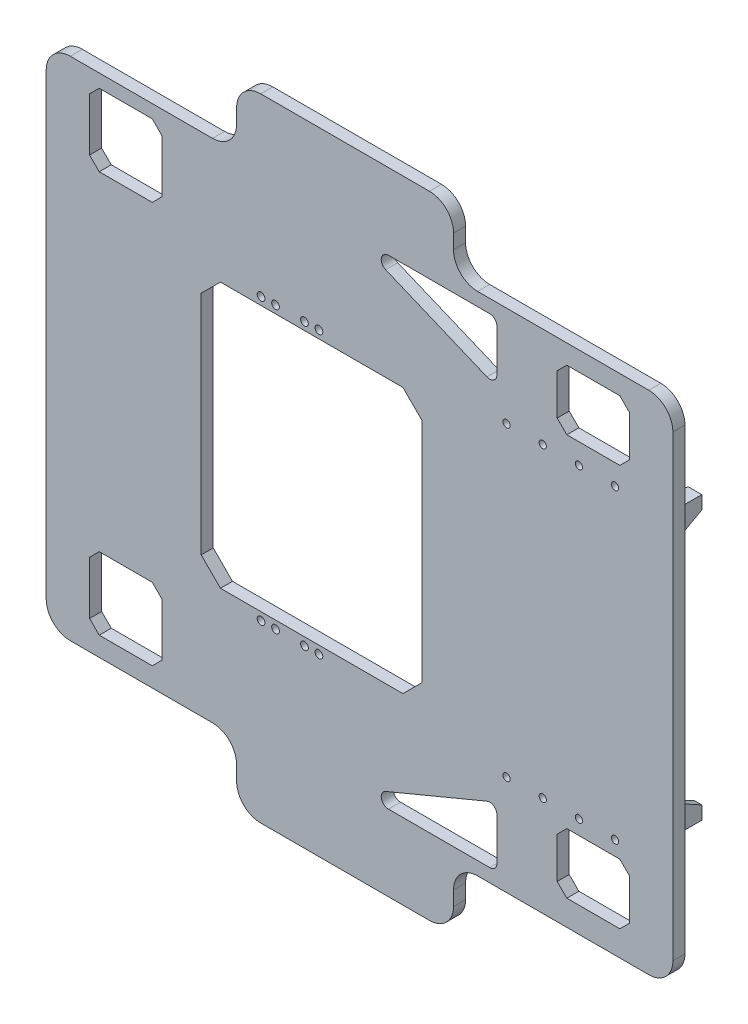
from build123d import *

# Parameters (mm, degrees)
EXTRUDE_1_DEPTH       = 5
CUT_EXTRUDE_1_DEPTH   = 185.623942109
CUT_EXTRUDE_2_DEPTH   = 185.623942109
EXTRUDE_2_DEPTH       = 15
CUT_EXTRUDE_3_DEPTH   = 10
CUT_EXTRUDE_4_DEPTH   = 10
MIRROR_2_COPY_1_DEPTH = 15
MIRROR_2_COPY_2_DEPTH = 10
MIRROR_2_COPY_3_DEPTH = 10
MIRROR_2_COPY_4_DEPTH = 15
MIRROR_2_COPY_5_DEPTH = 10
MIRROR_2_COPY_6_DEPTH = 10
SKETCH_7_R            = 1.6
CUT_EXTRUDE_5_DEPTH   = 186.16479147
SKETCH_8_R            = 1.5
CUT_EXTRUDE_6_DEPTH   = 186.16479147


with BuildPart() as part:
    # 草图1 → 凸台-拉伸1 (new body)
    with BuildSketch(Plane.XY):
        with BuildLine():
            Line((-51, 115), (-51, 121))
            ThreePointArc((-51, 121), (-48.071067812, 128.071067812), (-41, 131))
            Line((-41, 131), (29, 131))
            ThreePointArc((29, 131), (36.071067812, 128.071067812), (39, 121))
            Line((39, 121), (39, 115))
            ThreePointArc((39, 115), (41.928932188, 107.928932188), (49, 105))
            Line((49, 105), (120, 105))
            ThreePointArc((120, 105), (127.071067812, 102.071067812), (130, 95))
            Line((130, 95), (130, -95))
            ThreePointArc((130, -95), (127.071067812, -102.071067812), (120, -105))
            Line((120, -105), (49, -105))
            ThreePointArc((49, -105), (41.928932188, -107.928932188), (39, -115))
            Line((39, -115), (39, -121))
            ThreePointArc((39, -121), (36.071067812, -128.071067812), (29, -131))
            Line((29, -131), (-41, -131))
            ThreePointArc((-41, -131), (-48.071067812, -128.071067812), (-51, -121))
            Line((-51, -121), (-51, -115))
            ThreePointArc((-51, -115), (-53.928932188, -107.928932188), (-61, -105))
            Line((-61, -105), (-120, -105))
            ThreePointArc((-120, -105), (-127.071067812, -102.071067812), (-130, -95))
            Line((-130, -95), (-130, 95))
            ThreePointArc((-130, 95), (-127.071067812, 102.071067812), (-120, 105))
            Line((-120, 105), (-61, 105))
            ThreePointArc((-61, 105), (-53.928932188, 107.928932188), (-51, 115))
        make_face()
    extrude(amount=EXTRUDE_1_DEPTH)

    # 草图2 → 切除-拉伸1 (cut, through all)
    with BuildSketch(Plane.XY.offset(5)):
        with BuildLine():
            Line((10.846153846, -93.730769231), (52.846153846, -76.230769231))
            ThreePointArc((52.846153846, -76.230769231), (55.664100589, -76.503849117), (57, -79))
            Line((57, -79), (57, -96.5))
            ThreePointArc((57, -96.5), (56.121320344, -98.621320344), (54, -99.5))
            Line((54, -99.5), (12, -99.5))
            ThreePointArc((12, -99.5), (9.058257973, -97.088348405), (10.846153846, -93.730769231))
        make_face()
        Polygon((-108, 99.5), (-86, 99.5), (-82, 95.5), (-82, 73.5), (-86, 69.5), (-108, 69.5), (-112, 73.5), (-112, 95.5), align=None)
        Polygon((-108, -67), (-86, -67), (-82, -71), (-82, -93), (-86, -97), (-108, -97), (-112, -93), (-112, -71), align=None)
        Polygon((86, 97), (108, 97), (112, 93), (112, 76), (108, 72), (86, 72), (82, 76), (82, 93), align=None)
        Polygon((86, -69.5), (108, -69.5), (112, -73.5), (112, -90.5), (108, -94.5), (86, -94.5), (82, -90.5), (82, -73.5), align=None)
        with BuildLine():
            Line((12, 99.5), (54, 99.5))
            ThreePointArc((54, 99.5), (56.121320344, 98.621320344), (57, 96.5))
            Line((57, 96.5), (57, 79))
            ThreePointArc((57, 79), (55.664100589, 76.503849117), (52.846153846, 76.230769231))
            Line((52.846153846, 76.230769231), (10.846153846, 93.730769231))
            ThreePointArc((10.846153846, 93.730769231), (9.058257973, 97.088348405), (12, 99.5))
        make_face()
    extrude(amount=-CUT_EXTRUDE_1_DEPTH, mode=Mode.SUBTRACT)

    # 草图3 → 切除-拉伸2 (cut, through all)
    with BuildSketch(Plane(origin=(0, 0, 0), x_dir=(-1, 0, 0), z_dir=(0, 0, -1))):
        Polygon((57.7, 55), (-18, 55), (-26, 47), (-26, -47), (-18, -55), (57.7, -55), (65.7, -47), (65.7, 47), align=None)
    extrude(amount=-CUT_EXTRUDE_2_DEPTH, mode=Mode.SUBTRACT)

    # 草图4 → 凸台-拉伸2 (add)
    with BuildSketch(Plane(origin=(0, 0, 0), x_dir=(-1, 0, 0), z_dir=(0, 0, -1))):
        Polygon((-46, -47.5), (-46, -58.5), (-57, -58.5), (-57, -55.5), (-49, -55.5), (-49, -47.5), align=None)
    extrude_2 = extrude(amount=EXTRUDE_2_DEPTH)

    # 草图5 → 切除-拉伸3 (cut)
    with BuildSketch(Plane.XZ.offset(58.5)):
        Polygon((57, -5), (51.5, -15), (57, -15), align=None)
    cut_extrude_3 = extrude(amount=-CUT_EXTRUDE_3_DEPTH, mode=Mode.SUBTRACT)

    # 草图6 → 切除-拉伸4 (cut)
    with BuildSketch(Plane.ZY.offset(-46)):
        Polygon((-15, -53), (-5, -47.5), (-15, -47.5), align=None)
    cut_extrude_4 = extrude(amount=-CUT_EXTRUDE_4_DEPTH, mode=Mode.SUBTRACT)

    # 镜向1: 凸台-拉伸2, 切除-拉伸3, 切除-拉伸4 across plane
    add(extrude_2.mirror(Plane(origin=(84, 0, 0), x_dir=(0, 0, 1), z_dir=(1, 0, 0))))
    add(cut_extrude_3.mirror(Plane(origin=(84, 0, 0), x_dir=(0, 0, 1), z_dir=(1, 0, 0))), mode=Mode.SUBTRACT)
    add(cut_extrude_4.mirror(Plane(origin=(84, 0, 0), x_dir=(0, 0, 1), z_dir=(1, 0, 0))), mode=Mode.SUBTRACT)

    # 镜向2 copy 1 sketch → 镜向2 copy 1 (add)
    with BuildSketch(Plane(origin=(168, 0, 0), x_dir=(1, 0, 0), z_dir=(0, 0, -1))):
        Polygon((-46, -47.5), (-46, -58.5), (-57, -58.5), (-57, -55.5), (-49, -55.5), (-49, -47.5), align=None)
    extrude(amount=MIRROR_2_COPY_1_DEPTH)

    # 镜向2 copy 2 sketch → 镜向2 copy 2 (cut)
    with BuildSketch(Plane(origin=(168, 58.5, 0), x_dir=(-1, 0, 0), z_dir=(0, 1, 0))):
        Polygon((57, -5), (51.5, -15), (57, -15), align=None)
    extrude(amount=-MIRROR_2_COPY_2_DEPTH, mode=Mode.SUBTRACT)

    # 镜向2 copy 3 sketch → 镜向2 copy 3 (cut)
    with BuildSketch(Plane(origin=(122, 0, 0), x_dir=(0, 0, 1), z_dir=(1, 0, 0))):
        Polygon((-15, -53), (-5, -47.5), (-15, -47.5), align=None)
    extrude(amount=-MIRROR_2_COPY_3_DEPTH, mode=Mode.SUBTRACT)

    # 镜向2 copy 4 sketch → 镜向2 copy 4 (add)
    with BuildSketch(Plane(origin=(0, 0, 0), x_dir=(-1, 0, 0), z_dir=(0, 0, -1))):
        Polygon((-46, 47.5), (-46, 58.5), (-57, 58.5), (-57, 55.5), (-49, 55.5), (-49, 47.5), align=None)
    extrude(amount=MIRROR_2_COPY_4_DEPTH)

    # 镜向2 copy 5 sketch → 镜向2 copy 5 (cut)
    with BuildSketch(Plane(origin=(0, 58.5, 0), x_dir=(1, 0, 0), z_dir=(0, 1, 0))):
        Polygon((57, 5), (51.5, 15), (57, 15), align=None)
    extrude(amount=-MIRROR_2_COPY_5_DEPTH, mode=Mode.SUBTRACT)

    # 镜向2 copy 6 sketch → 镜向2 copy 6 (cut)
    with BuildSketch(Plane.ZY.offset(-46)):
        Polygon((-15, 53), (-5, 47.5), (-15, 47.5), align=None)
    extrude(amount=-MIRROR_2_COPY_6_DEPTH, mode=Mode.SUBTRACT)

    # 草图7 → 切除-拉伸5 (cut, through all)
    with BuildSketch(Plane(origin=(0, 0, 0), x_dir=(-1, 0, 0), z_dir=(0, 0, -1))):
        with Locations((16.85, -58.25)):
            Circle(SKETCH_7_R)
        with Locations((22.85, -58.25)):
            Circle(SKETCH_7_R)
        with Locations((40.85, -58.25)):
            Circle(SKETCH_7_R)
        with Locations((34.85, -58.25)):
            Circle(SKETCH_7_R)
    cut_extrude_5 = extrude(amount=-CUT_EXTRUDE_5_DEPTH, mode=Mode.SUBTRACT)

    # 镜向3: 切除-拉伸5 across plane
    add(cut_extrude_5.mirror(Plane.ZX), mode=Mode.SUBTRACT)

    # 草图8 → 切除-拉伸6 (cut, through all)
    with BuildSketch(Plane(origin=(0, 0, 0), x_dir=(-1, 0, 0), z_dir=(0, 0, -1))):
        with Locations((-61, -63.5)):
            Circle(SKETCH_8_R)
        with Locations((-76, -63.5)):
            Circle(SKETCH_8_R)
        with Locations((-91, -63.5)):
            Circle(SKETCH_8_R)
        with Locations((-106, -63.5)):
            Circle(SKETCH_8_R)
        with Locations((-106, 63.5)):
            Circle(SKETCH_8_R)
        with Locations((-91, 63.5)):
            Circle(SKETCH_8_R)
        with Locations((-76, 63.5)):
            Circle(SKETCH_8_R)
        with Locations((-61, 63.5)):
            Circle(SKETCH_8_R)
    extrude(amount=-CUT_EXTRUDE_6_DEPTH, mode=Mode.SUBTRACT)


solid = part.part
